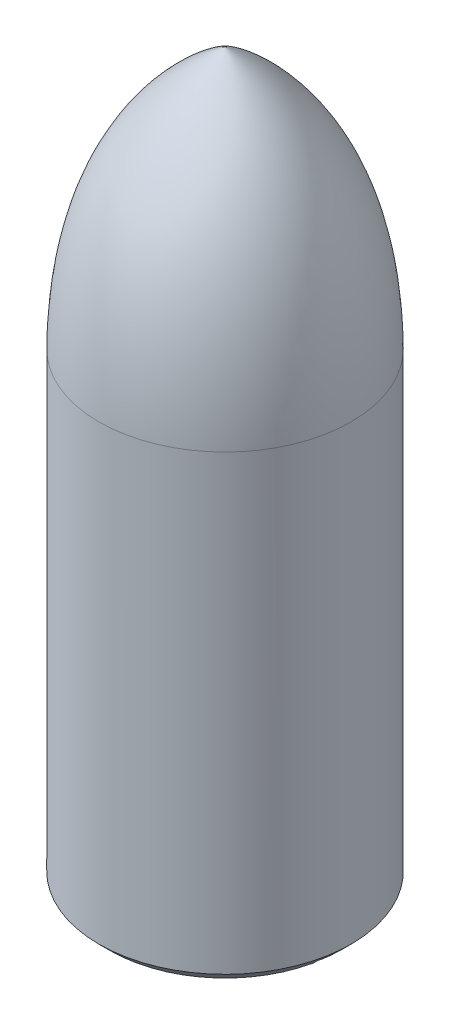
from build123d import *

# Parameters (mm, degrees)
SKETCH1_R           = 34
BOSS_EXTRUDE1_DEPTH = 125
CHAMFER1_SIZE       = 3


with BuildPart() as part:
    # Sketch1 → Boss-Extrude1 (new body)
    with BuildSketch(Plane(origin=(0, 0, 0), x_dir=(1, 0, 0), z_dir=(0, 1, 0))):
        with Locations(Location((0, 0, 0), (0, 0, 270))):
            Circle(SKETCH1_R)
        with BuildLine():
            Line((31.5, 6.5), (31.5, -6.5))
            Line((31.5, -6.5), (25.690465157, -6.5))
            ThreePointArc((25.690465157, -6.5), (0, -26.5), (-25.690465157, -6.5))
            Line((-25.690465157, -6.5), (-31.5, -6.5))
            Line((-31.5, -6.5), (-31.5, 6.5))
            Line((-31.5, 6.5), (-25.690465157, 6.5))
            ThreePointArc((-25.690465157, 6.5), (0, 26.5), (25.690465157, 6.5))
            Line((25.690465157, 6.5), (31.5, 6.5))
        make_face(mode=Mode.SUBTRACT)
    extrude(amount=BOSS_EXTRUDE1_DEPTH)

    # Sketch2 → Revolve1 (revolve)
    with BuildSketch(Plane.XY):
        with BuildLine():
            Line((0, 125), (0, 195.638896549))
            add(Edge.make_bspline(
                [(0, 195.638896549), (33.497794894, 174.990797279), (34, 125)],
                knots=[0, 0, 0, 1, 1, 1], degree=2))
            Line((34, 125), (0, 125))
        make_face()
    revolve(axis=Axis((0, 125, 0), (0, 1, 0)))

    # Chamfer1
    # the kernel refuses this chamfer: 3 mm, written as the material it takes off along each edge
    with BuildSketch(Plane(origin=(0, 0, 0), x_dir=(0, 0, 1), z_dir=(-1, 0, 0))) as chamfer1_piece_1:
        Polygon((34, CHAMFER1_SIZE), (34 - CHAMFER1_SIZE, 0), (34, 0), align=None)
    revolve(axis=Axis((0, 0, 0), (0, 1, 0)), mode=Mode.SUBTRACT)


solid = part.part
